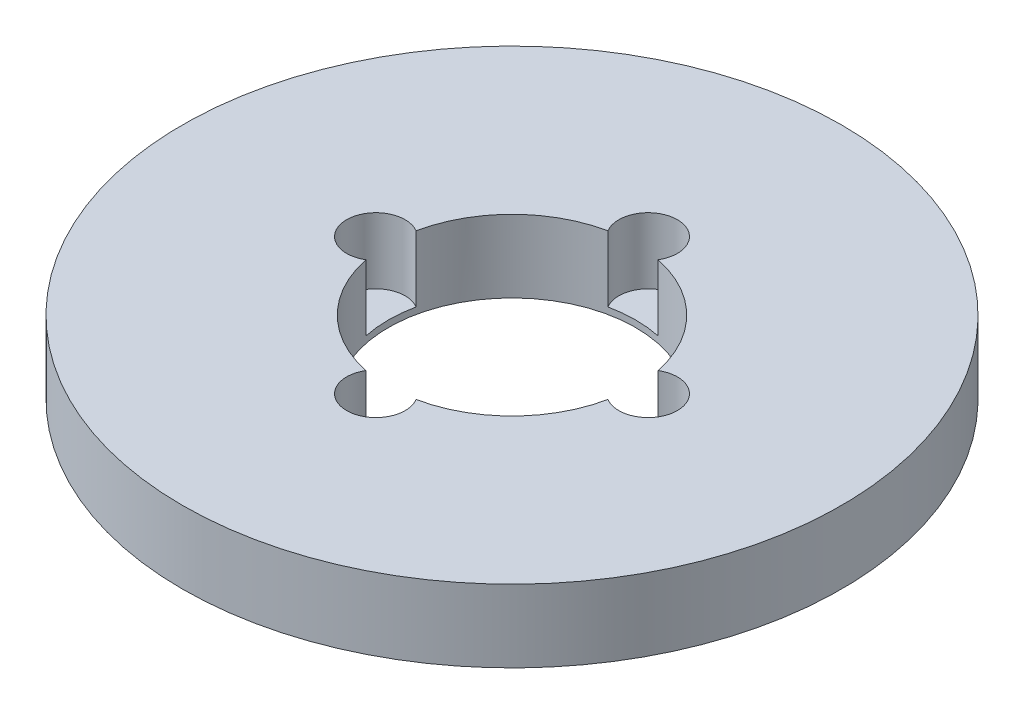
from build123d import *

# Parameters (mm, degrees)
SKETCH1_R           = 100
BOSS_EXTRUDE1_DEPTH = 22
SKETCH2_R           = 37.5
CUT_EXTRUDE1_DEPTH  = 144.122325303
SKETCH3_R           = 8.879303671
CUT_EXTRUDE2_DEPTH  = 20.00640885
CIRPATTERN1_COUNT   = 4


with BuildPart() as part:
    # Sketch1 → Boss-Extrude1 (new body)
    with BuildSketch(Plane(origin=(0, 0, 0), x_dir=(1, 0, 0), z_dir=(0, 1, 0))):
        Circle(SKETCH1_R)
    extrude(amount=BOSS_EXTRUDE1_DEPTH)

    # Sketch2 → Cut-Extrude1 (cut, through all)
    with BuildSketch(Plane(origin=(0, 0, 0), x_dir=(1, 0, 0), z_dir=(0, 1, 0))):
        Circle(SKETCH2_R)
    extrude(amount=CUT_EXTRUDE1_DEPTH, mode=Mode.SUBTRACT)

    # Sketch3 → Cut-Extrude2 (cut)
    with BuildSketch(Plane(origin=(0, 22, 0), x_dir=(1, 0, 0), z_dir=(0, 1, 0))):
        with Locations((-41.297540338, 0)):
            Circle(SKETCH3_R)
    cut_extrude2 = extrude(amount=-CUT_EXTRUDE2_DEPTH, mode=Mode.SUBTRACT)

    # CirPattern1: Cut-Extrude2 ×4 about axis
    cirpattern1_axis = Axis((0, 0, 0), (0, 1, 0))
    for i in range(1, CIRPATTERN1_COUNT):
        add(cut_extrude2.rotate(cirpattern1_axis, i * 360 / CIRPATTERN1_COUNT), mode=Mode.SUBTRACT)


solid = part.part
